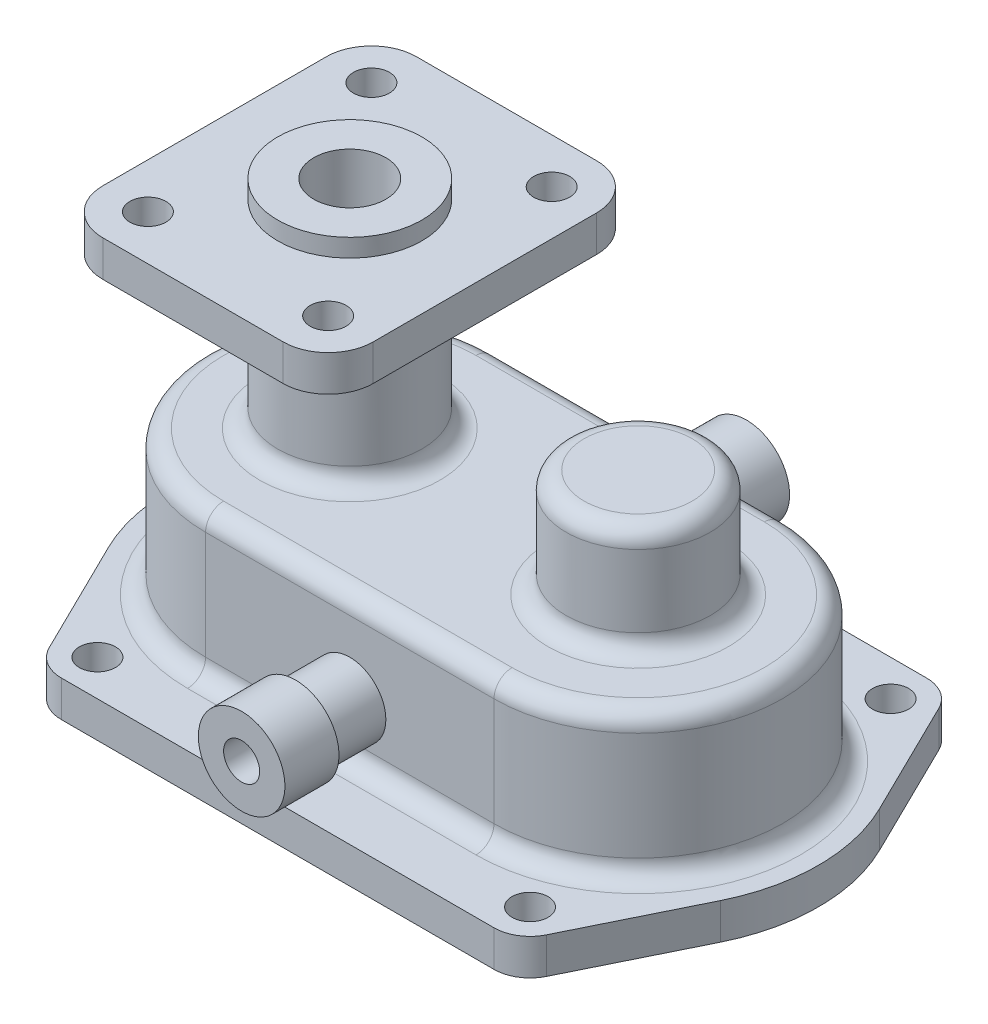
from build123d import *

# Parameters (mm, degrees)
SKETCH1_R           = 5
BOSS_EXTRUDE1_DEPTH = 10
BOSS_EXTRUDE2_DEPTH = 40
SHELL2_DEPTH        = 40
BOSS_EXTRUDE3_START = -10
SKETCH3_R           = 20
BOSS_EXTRUDE3_DEPTH = 30
SKETCH4_R           = 10
CUT_EXTRUDE1_DEPTH  = 30
SKETCH5_R           = 20
SKETCH5_R_2         = 10
BOSS_EXTRUDE4_DEPTH = 70
SKETCH5_3_R         = 10
CUT_EXTRUDE3_DEPTH  = 10
BOSS_EXTRUDE6_START = -15
SKETCH7_R           = 20
SKETCH7_R_2         = 5
BOSS_EXTRUDE6_DEPTH = 10
SKETCH10_R          = 10
SKETCH10_R_2        = 5
BOSS_EXTRUDE7_DEPTH = 70
CUT_EXTRUDE4_DEPTH  = 40
SKETCH12_R          = 5
CUT_EXTRUDE5_DEPTH  = 142.5
BOSS_EXTRUDE8_START = -15
SKETCH13_R          = 12
SKETCH13_R_2        = 10
BOSS_EXTRUDE8_DEPTH = 15
FILLET1_R           = 5


# Read off the part's stored shape, not the designer's step: Shell2
with BuildPart() as part:
    # Sketch1 → Boss-Extrude1 (new body)
    with BuildSketch(Plane(origin=(0, 0, 0), x_dir=(1, 0, 0), z_dir=(0, 1, 0))):
        with BuildLine():
            Line((-60, -60), (60, -60))
            ThreePointArc((60, -60), (65.286792677, -58.488216726), (68.975088406, -54.409964638))
            Line((68.975088406, -54.409964638), (84.87544203, -22.049823188))
            ThreePointArc((84.87544203, -22.049823188), (90, 0), (84.87544203, 22.049823188))
            Line((84.87544203, 22.049823188), (68.975088406, 54.409964638))
            ThreePointArc((68.975088406, 54.409964638), (65.286792677, 58.488216726), (60, 60))
            Line((60, 60), (-60, 60))
            ThreePointArc((-60, 60), (-65.286792677, 58.488216726), (-68.975088406, 54.409964638))
            Line((-68.975088406, 54.409964638), (-84.87544203, 22.049823188))
            ThreePointArc((-84.87544203, 22.049823188), (-90, 0), (-84.87544203, -22.049823188))
            Line((-84.87544203, -22.049823188), (-68.975088406, -54.409964638))
            ThreePointArc((-68.975088406, -54.409964638), (-65.286792677, -58.488216726), (-60, -60))
        make_face()
        with Locations(Location((-60, 50, 0), (0, 0, 270))):
            Circle(SKETCH1_R, mode=Mode.SUBTRACT)
        with Locations(Location((-60, -50, 0), (0, 0, 270))):
            Circle(SKETCH1_R, mode=Mode.SUBTRACT)
        with Locations(Location((60, -50, 0), (0, 0, 90))):
            Circle(SKETCH1_R, mode=Mode.SUBTRACT)
        with Locations(Location((60, 50, 0), (0, 0, 90))):
            Circle(SKETCH1_R, mode=Mode.SUBTRACT)
    extrude(amount=BOSS_EXTRUDE1_DEPTH)

    # Sketch2 → Boss-Extrude2 (add)
    with BuildSketch(Plane(origin=(0, 10, 0), x_dir=(1, 0, 0), z_dir=(0, 1, 0))):
        with BuildLine():
            Line((-40, 40), (40, 40))
            ThreePointArc((40, 40), (80, 0), (40, -40))
            Line((40, -40), (-40, -40))
            ThreePointArc((-40, -40), (-80, 0), (-40, 40))
        make_face()
    extrude(amount=BOSS_EXTRUDE2_DEPTH)

    # Shell2 outline → Shell2 (cut)
    with BuildSketch(Plane(origin=(0, 0, 0), x_dir=(1, 0, 0), z_dir=(0, 1, 0))):
        with BuildLine():
            ThreePointArc((-40, 30), (-70, 0), (-40, -30))
            Line((-40, -30), (40, -30))
            ThreePointArc((40, -30), (70, 0), (40, 30))
            Line((40, 30), (-40, 30))
        make_face()
    extrude(amount=SHELL2_DEPTH, mode=Mode.SUBTRACT)

    # Sketch3 → Boss-Extrude3 (add)
    with BuildSketch(Plane.XZ.offset(-40).offset(BOSS_EXTRUDE3_START)):
        with Locations(Location((40, 0, 0), (0, 0, 270))):
            Circle(SKETCH3_R)
    extrude(amount=-BOSS_EXTRUDE3_DEPTH)

    # Sketch4 → Cut-Extrude1 (cut)
    with BuildSketch(Plane.XZ.offset(-40)):
        with Locations(Location((40, 0, 0), (0, 0, 270))):
            Circle(SKETCH4_R)
    extrude(amount=-CUT_EXTRUDE1_DEPTH, mode=Mode.SUBTRACT)

    # Sketch5 → Boss-Extrude4 (add)
    with BuildSketch(Plane.XZ.offset(-40)):
        with Locations(Location((-40, 0, 0), (0, 0, 270))):
            Circle(SKETCH5_R)
        with Locations(Location((-40, 0, 0), (0, 0, 270))):
            Circle(SKETCH5_R_2, mode=Mode.SUBTRACT)
    extrude(amount=-BOSS_EXTRUDE4_DEPTH)

    # Sketch5<3> → Cut-Extrude3 (cut)
    with BuildSketch(Plane.XZ.offset(-40)):
        with Locations(Location((-40, 0, 0), (0, 0, 270))):
            Circle(SKETCH5_3_R)
    extrude(amount=-CUT_EXTRUDE3_DEPTH, mode=Mode.SUBTRACT)

    # Sketch7 → Boss-Extrude6 (add)
    with BuildSketch(Plane(origin=(0, 110, 0), x_dir=(1, 0, 0), z_dir=(0, 1, 0)).offset(BOSS_EXTRUDE6_START)):
        with BuildLine():
            Line((-65, -43.5), (-15, -43.5))
            ThreePointArc((-15, -43.5), (-6.161165235, -39.838834765), (-2.5, -31))
            Line((-2.5, -31), (-2.5, 31))
            ThreePointArc((-2.5, 31), (-6.161165235, 39.838834765), (-15, 43.5))
            Line((-15, 43.5), (-65, 43.5))
            ThreePointArc((-65, 43.5), (-73.838834765, 39.838834765), (-77.5, 31))
            Line((-77.5, 31), (-77.5, -31))
            ThreePointArc((-77.5, -31), (-73.838834765, -39.838834765), (-65, -43.5))
        make_face()
        with Locations(Location((-40, 0, 0), (0, 0, 90))):
            Circle(SKETCH7_R, mode=Mode.SUBTRACT)
        with Locations(Location((-15, 31, 0), (0, 0, 270))):
            Circle(SKETCH7_R_2, mode=Mode.SUBTRACT)
        with Locations(Location((-65, 31, 0), (0, 0, 270))):
            Circle(SKETCH7_R_2, mode=Mode.SUBTRACT)
        with Locations(Location((-15, -31, 0), (0, 0, 270))):
            Circle(SKETCH7_R_2, mode=Mode.SUBTRACT)
        with Locations(Location((-65, -31, 0), (0, 0, 270))):
            Circle(SKETCH7_R_2, mode=Mode.SUBTRACT)
    extrude(amount=BOSS_EXTRUDE6_DEPTH)

    # Sketch10 → Boss-Extrude7 (add, symmetric)
    with BuildSketch(Plane.XY):
        with Locations(Location((0, 25, 0), (0, 0, 180))):
            Circle(SKETCH10_R)
        with Locations((0, 25)):
            Circle(SKETCH10_R_2, mode=Mode.SUBTRACT)
    extrude(amount=BOSS_EXTRUDE7_DEPTH, both=True)

    # Sketch11 → Cut-Extrude4 (cut)
    with BuildSketch(Plane.XZ):
        with BuildLine():
            Line((-40, 30), (40, 30))
            ThreePointArc((40, 30), (70, 0), (40, -30))
            Line((40, -30), (-40, -30))
            ThreePointArc((-40, -30), (-70, 0), (-40, 30))
        make_face()
    extrude(amount=-CUT_EXTRUDE4_DEPTH, mode=Mode.SUBTRACT)

    # Sketch12 → Cut-Extrude5 (cut, symmetric)
    with BuildSketch(Plane(origin=(0, 0, -40), x_dir=(-1, 0, 0), z_dir=(0, 0, -1))):
        with Locations(Location((0, 25, 0), (0, 0, 180))):
            Circle(SKETCH12_R)
    extrude(amount=CUT_EXTRUDE5_DEPTH, both=True, mode=Mode.SUBTRACT)

    # Sketch13 → Boss-Extrude8 (add)
    with BuildSketch(Plane(origin=(0, 0, -70), x_dir=(-1, 0, 0), z_dir=(0, 0, -1)).offset(BOSS_EXTRUDE8_START)):
        with Locations((0, 25)):
            Circle(SKETCH13_R)
        with Locations((0, 25)):
            Circle(SKETCH13_R_2, mode=Mode.SUBTRACT)
    boss_extrude8 = extrude(amount=BOSS_EXTRUDE8_DEPTH)

    # Mirror1: Boss-Extrude8 across plane
    add(boss_extrude8.mirror(Plane.XY))

    # Fillet1
    fillet1_edges = [part.edges().sort_by_distance(p)[0] for p in [
        (-40, 95, 20),
        (-80, 10, 0),
        (0, 10, 40),
        (80, 10, 0),
        (0, 10, -40),
        (-80, 50, 0),
        (0, 50, 40),
        (80, 50, 0),
        (0, 50, -40),
        (-70, 40, 0),
        (0, 40, 30),
        (70, 40, 0),
        (0, 40, -30),
        (40, 50, 20),
        (40, 80, 20),
        (-40, 50, 20),
    ]]
    fillet(fillet1_edges, radius=FILLET1_R - 0.0001)  # a hair under: the kernel refuses the full size


solid = part.part
